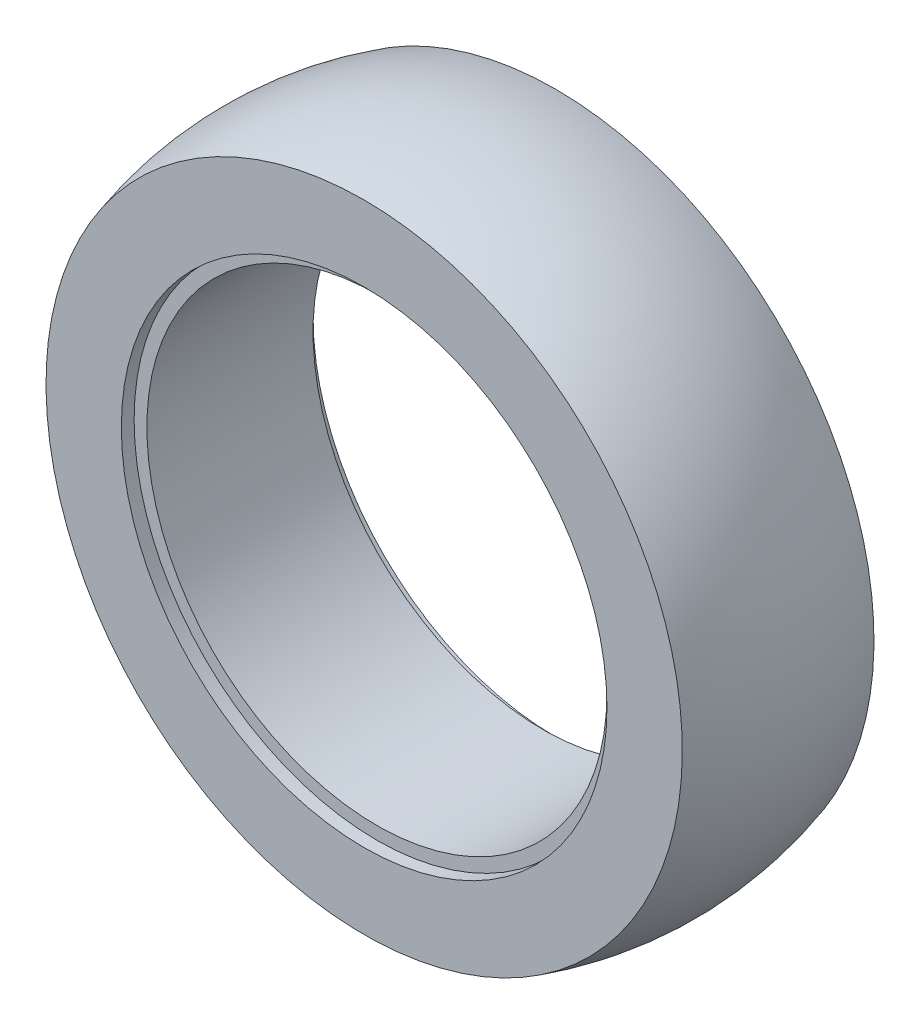
from build123d import *


with BuildPart() as part:
    # Esquisse1 → Révolution1 (revolve)
    with BuildSketch(Plane(origin=(0, 0, 0), x_dir=(0, 0, -1), z_dir=(1, 0, 0))):
        with BuildLine():
            Line((-6.5, 18), (6.5, 18))
            Line((6.5, 18), (6.5, 19))
            Line((6.5, 19), (7.5, 19))
            Line((7.5, 19), (7.5, 24.894778569))
            ThreePointArc((7.5, 24.894778569), (0, 26), (-7.5, 24.894778569))
            Line((-7.5, 24.894778569), (-7.5, 19))
            Line((-7.5, 19), (-6.5, 19))
            Line((-6.5, 19), (-6.5, 18))
        make_face()
    revolve(axis=Axis((0, 0, 2.4656375), (0, 0, -1)))


solid = part.part
